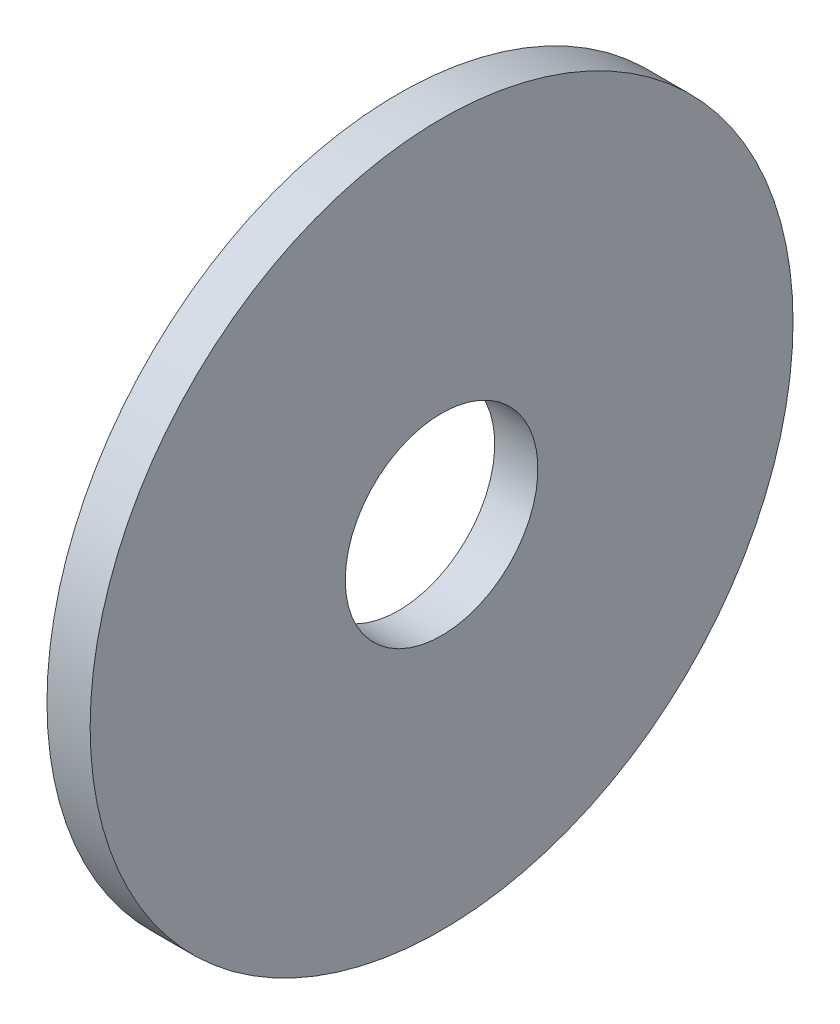
from build123d import *

# Parameters (mm, degrees)
SKETCH1_W = 6.0452
SKETCH1_H = 35.7251


with BuildPart() as part:
    # Sketch1 → Base-Revolve (revolve)
    with BuildSketch(Plane.XY):
        with Locations((-3.0226, 31.34995)):
            Rectangle(SKETCH1_W, SKETCH1_H)
    revolve(axis=Axis((-34.925, 0, 0), (1, 0, 0)))


solid = part.part
